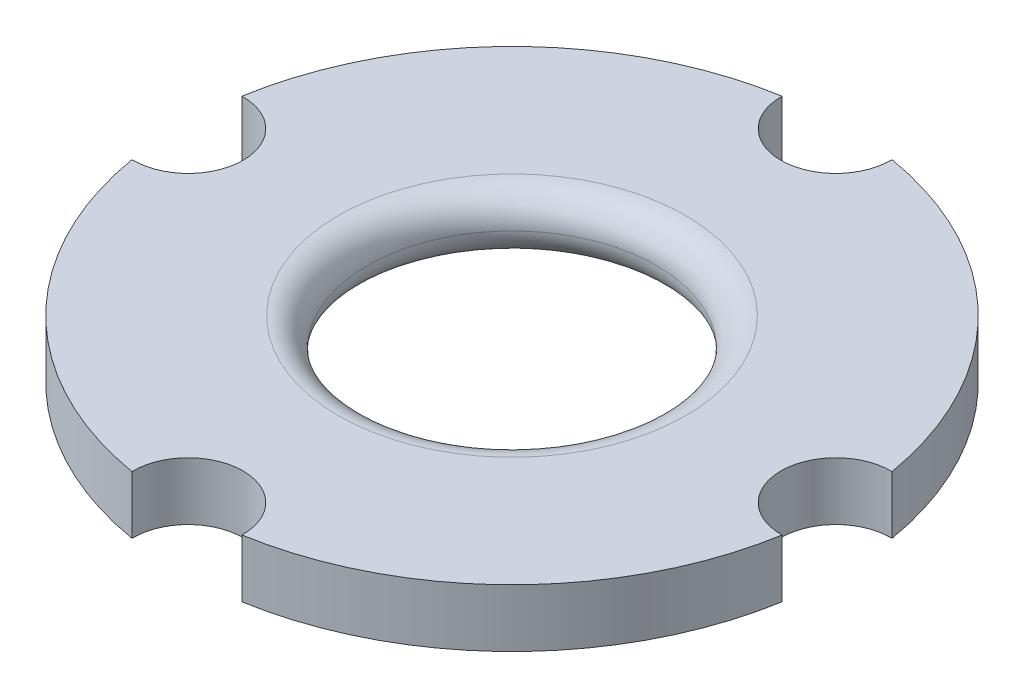
from build123d import *

# Parameters (mm, degrees)
SKETCH2_R           = 13.2
BOSS_EXTRUDE1_DEPTH = 2
SKETCH3_R           = 1.9
CUT_EXTRUDE1_DEPTH  = 2
SKETCH4_R           = 5
CUT_EXTRUDE2_DEPTH  = 2
CIRPATTERN1_COUNT   = 4
FILLET2_R           = 1
CUT_EXTRUDE3_START  = -10
SKETCH6_R           = 13.2
SKETCH6_R_2         = 11.4
CUT_EXTRUDE3_DEPTH  = 10


with BuildPart() as part:
    # Sketch2 → Boss-Extrude1 (new body)
    with BuildSketch(Plane(origin=(0, 0, 0), x_dir=(1, 0, 0), z_dir=(0, 1, 0))):
        with Locations(Location((0, 0, 0), (0, 0, 270))):
            Circle(SKETCH2_R)
    extrude(amount=BOSS_EXTRUDE1_DEPTH)

    # Sketch3 → Cut-Extrude1 (cut)
    with BuildSketch(Plane(origin=(0, 2, 0), x_dir=(1, 0, 0), z_dir=(0, 1, 0))):
        with Locations(Location((0, 11.2, 0), (0, 0, 270))):
            Circle(SKETCH3_R)
    cut_extrude1 = extrude(amount=-CUT_EXTRUDE1_DEPTH, mode=Mode.SUBTRACT)

    # Sketch4 → Cut-Extrude2 (cut)
    with BuildSketch(Plane(origin=(0, 2, 0), x_dir=(1, 0, 0), z_dir=(0, 1, 0))):
        with Locations(Location((0, 0, 0), (0, 0, 270))):
            Circle(SKETCH4_R)
    extrude(amount=-CUT_EXTRUDE2_DEPTH, mode=Mode.SUBTRACT)

    # CirPattern1: Cut-Extrude1 ×4 about axis
    cirpattern1_axis = Axis((0, 0, 0), (0, 1, 0))
    for i in range(1, CIRPATTERN1_COUNT):
        add(cut_extrude1.rotate(cirpattern1_axis, i * 360 / CIRPATTERN1_COUNT), mode=Mode.SUBTRACT)

    # Fillet2
    fillet2_edges = [part.edges().sort_by_distance(p)[0] for p in [
        (0, 0, -5),
        (0, 2, -5),
    ]]
    fillet(fillet2_edges, radius=FILLET2_R - 0.0001)  # a hair under: the kernel refuses the full size

    # Sketch6 → Cut-Extrude3 (cut)
    with BuildSketch(Plane(origin=(0, 2, 0), x_dir=(1, 0, 0), z_dir=(0, 1, 0)).offset(CUT_EXTRUDE3_START)):
        Circle(SKETCH6_R)
        Circle(SKETCH6_R_2, mode=Mode.SUBTRACT)
    extrude(amount=CUT_EXTRUDE3_DEPTH, mode=Mode.SUBTRACT)


solid = part.part
